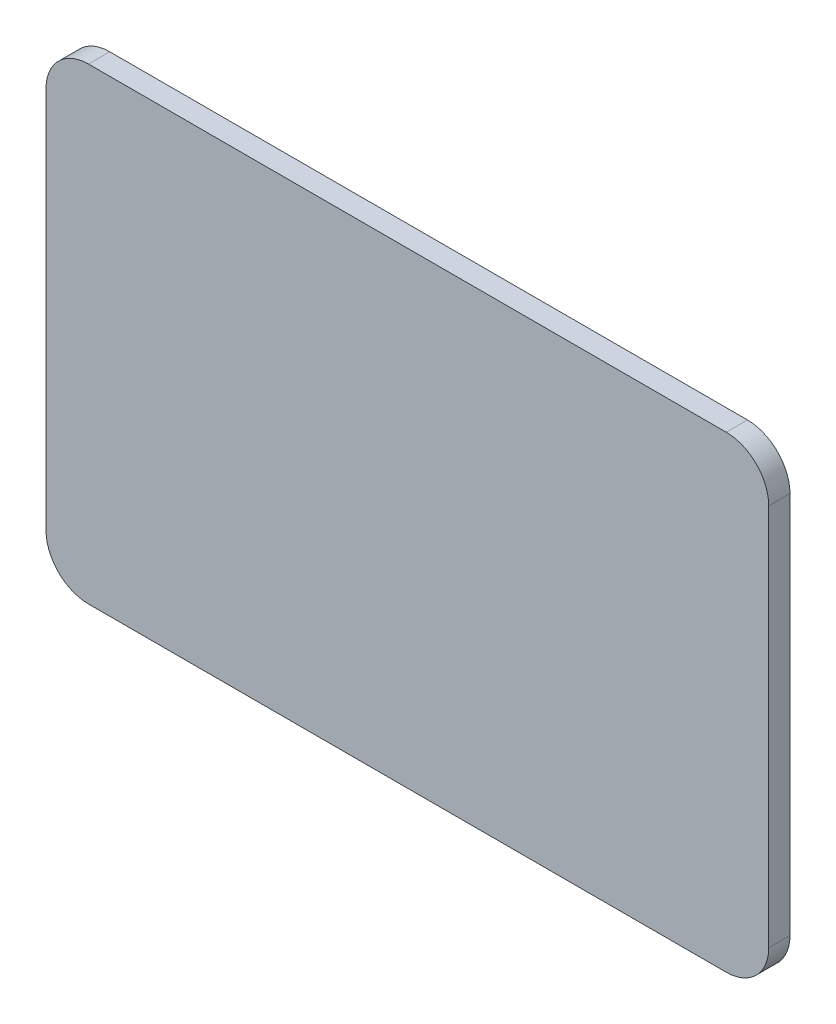
from build123d import *

# Parameters (mm, degrees)
SKETCH1_W           = 107.95
SKETCH1_H           = 69.85
BOSS_EXTRUDE1_DEPTH = 3.175
FILLET1_R           = 6.35


with BuildPart() as part:
    # Sketch1 → Boss-Extrude1 (new body)
    with BuildSketch(Plane.XY):
        Rectangle(SKETCH1_W, SKETCH1_H)
    extrude(amount=BOSS_EXTRUDE1_DEPTH)

    # Fillet1
    fillet1_edges = [part.edges().sort_by_distance(p)[0] for p in [
        (53.975, -34.925, 1.5875),
        (53.975, 34.925, 1.5875),
        (-53.975, 34.925, 1.5875),
        (-53.975, -34.925, 1.5875),
    ]]
    fillet(fillet1_edges, radius=FILLET1_R)


solid = part.part
